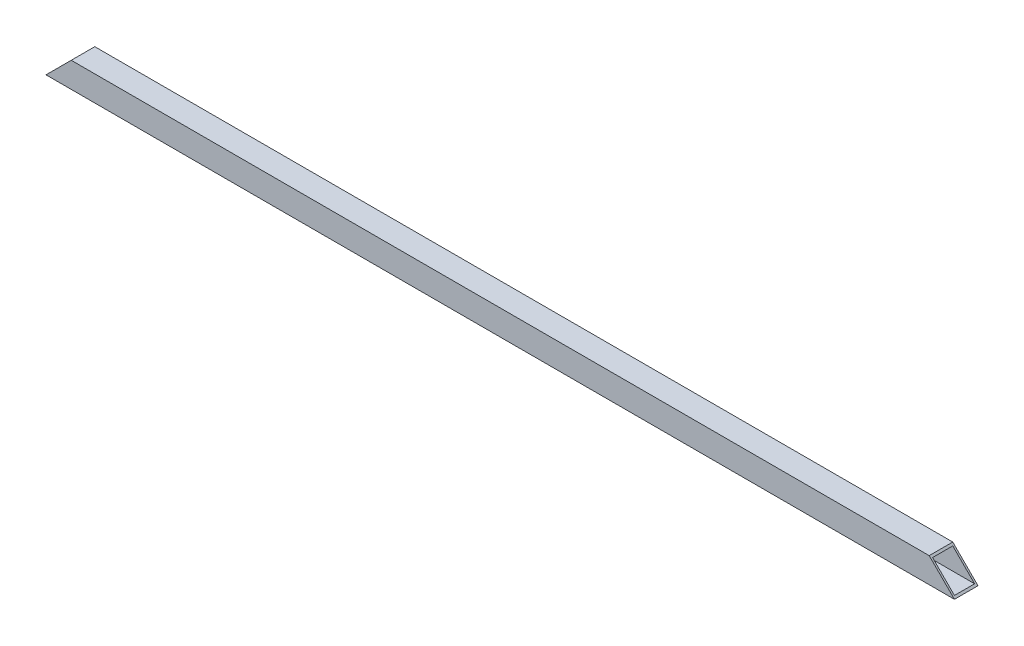
from build123d import *

# Parameters (mm, degrees)
SKETCH_2_W          = 70
SKETCH_2_H          = 75
SKETCH_2_W_2        = 60
SKETCH_2_H_2        = 65
EXTRUDE_1_DEPTH     = 2700
SKETCH_3_OUTSIDE_W  = 3242.39
SKETCH_3_OUTSIDE_H  = 617.39
CUT_EXTRUDE_1_DEPTH = 2702.167571625


with BuildPart() as part:
    # Эскиз2 → Вытянуть-Тонкостенный1 (new body)
    with BuildSketch(Plane(origin=(0, 0, 0), x_dir=(0, 0, -1), z_dir=(1, 0, 0))):
        Rectangle(SKETCH_2_W, SKETCH_2_H)
        Rectangle(SKETCH_2_W_2, SKETCH_2_H_2, mode=Mode.SUBTRACT)
    extrude(amount=EXTRUDE_1_DEPTH)

    # Эскиз3 outside → Вырез-Вытянуть1 (cut, through all)
    with BuildSketch(Plane(origin=(0, 0, -35), x_dir=(-1, 0, 0), z_dir=(0, 0, -1))):
        with Locations((-1350, 0)):
            Rectangle(SKETCH_3_OUTSIDE_W, SKETCH_3_OUTSIDE_H)
        Polygon((-2700, -37.5), (-2625, 37.5), (-75, 37.5), (0, -37.5), align=None, mode=Mode.SUBTRACT)
    extrude(amount=-CUT_EXTRUDE_1_DEPTH, mode=Mode.SUBTRACT)


solid = part.part
